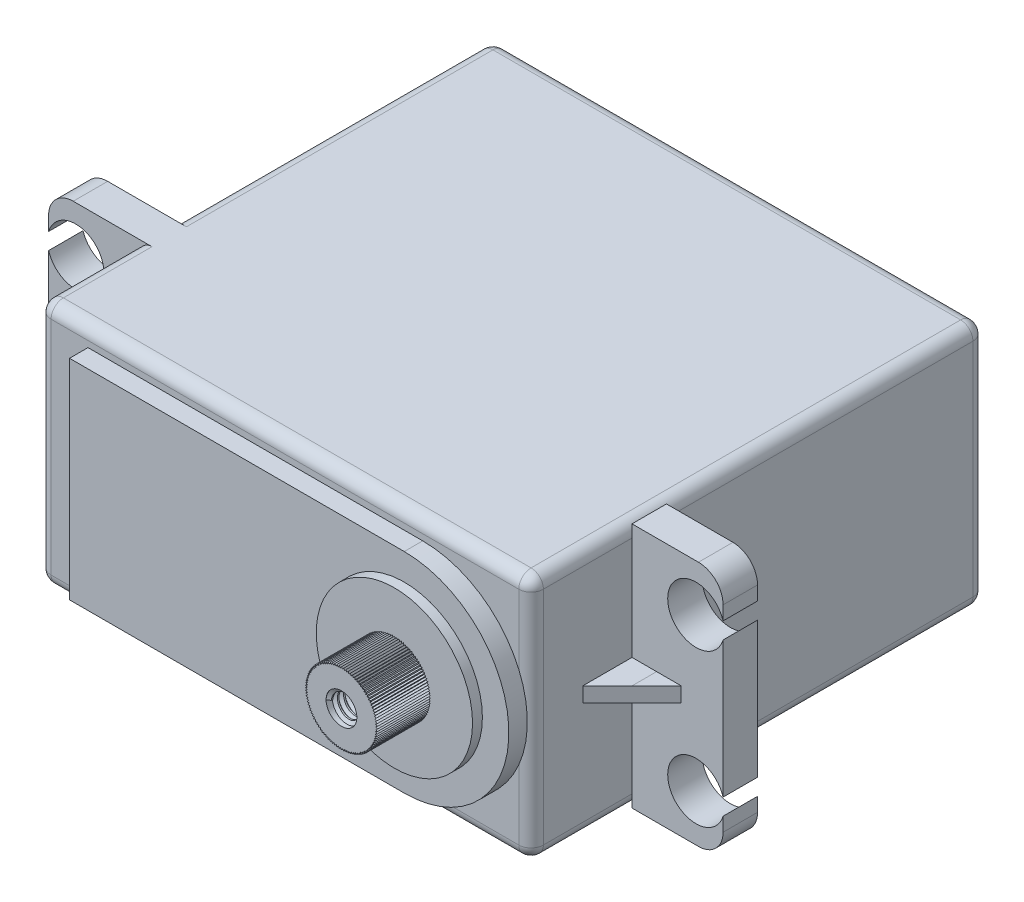
from build123d import *
from build123d.topology import SkipClean

# Parameters (mm, degrees)
SKETCH1_W            = 40
SKETCH1_H            = 20
BOSS_EXTRUDE1_DEPTH  = 36.9
SKETCH2_W            = 2.8
SKETCH2_H            = 20
BOSS_EXTRUDE2_DEPTH  = 7.4
SKETCH3_R            = 2.3
CUT_EXTRUDE1_DEPTH   = 41.920044
FILLET1_R            = 2
RIB5_OUTLINE_W       = 4
RIB5_OUTLINE_H       = 1.2
RIB5_DEPTH           = 4
CUT_EXTRUDE2_DEPTH   = 48.167044
SKETCH6_W            = 3.7
SKETCH6_H            = 6.3
BOSS_EXTRUDE3_DEPTH  = 5
FILLET3_R            = 1
BOSS_EXTRUDE4_DEPTH  = 1.5
SKETCH8_R            = 6.35
BOSS_EXTRUDE5_DEPTH  = 0.8
BOSS_EXTRUDE6_DEPTH  = 4.3
SKETCH10_R           = 1.25
CUT_EXTRUDE3_DEPTH   = 6
THREAD1_PITCH        = 0.5
FILLET1_OF_MIRROR1_R = 2


# Read off the part's stored shape, not the designer's step: Rib5
with BuildPart() as part:
    # Sketch1 → Boss-Extrude1 (new body)
    with BuildSketch(Plane.XY):
        Rectangle(SKETCH1_W, SKETCH1_H)
    extrude(amount=BOSS_EXTRUDE1_DEPTH)

    # Sketch2 → Boss-Extrude2 (add)
    with BuildSketch(Plane.ZY.offset(20)):
        with Locations((27.3, 0)):
            Rectangle(SKETCH2_W, SKETCH2_H)
    boss_extrude2 = extrude(amount=BOSS_EXTRUDE2_DEPTH)

    # Sketch3 → Cut-Extrude1 (cut, through all)
    with BuildSketch(Plane.XY.offset(28.7)):
        with Locations((-25.2, 6.2)):
            Circle(SKETCH3_R)
        with Locations((-25.2, -6.2)):
            Circle(SKETCH3_R)
    cut_extrude1 = extrude(amount=-CUT_EXTRUDE1_DEPTH, mode=Mode.SUBTRACT)

    # Fillet1
    fillet1_edges = [part.edges().sort_by_distance(p)[0] for p in [
        (-27.4, -10, 27.3),
        (-27.4, 10, 27.3),
    ]]
    fillet(fillet1_edges, radius=FILLET1_R)

    # Rib5 outline → Rib5 (add)
    with BuildSketch(Plane.XY.offset(28.7)):
        with Locations((-22, 0)):
            Rectangle(RIB5_OUTLINE_W, RIB5_OUTLINE_H)
    rib5 = extrude(amount=RIB5_DEPTH)

    # Sketch5 → Cut-Extrude2 (cut, through all)
    with BuildSketch(Plane.XZ.offset(0.6)):
        Polygon((-24, 32.7), (-24, 28.7), (-20, 32.7), align=None)
    cut_extrude2 = extrude(amount=-CUT_EXTRUDE2_DEPTH, mode=Mode.SUBTRACT)

    # Sketch6 → Boss-Extrude3 (add)
    with BuildSketch(Plane.ZY.offset(20)):
        with Locations((4.098205, 0)):
            Rectangle(SKETCH6_W, SKETCH6_H)
    extrude(amount=BOSS_EXTRUDE3_DEPTH)

    # Fillet3
    fillet3_edges = [part.edges().sort_by_distance(p)[0] for p in [
        (-20, 0, 5.948205),
        (-22.5, -3.15, 5.948205),
        (-20, 3.15, 4.098205),
        (-22.5, 3.15, 5.948205),
        (-20, 0, 2.248205),
        (-22.5, 3.15, 2.248205),
        (-20, -3.15, 4.098205),
        (-22.5, -3.15, 2.248205),
        (-25, 0, 5.948205),
        (-25, 3.15, 4.098205),
        (-25, 0, 2.248205),
        (-25, -3.15, 4.098205),
        (-20, 0, 36.9),
        (-20, -10, 12.95),
        (-20, 10, 12.95),
        (0, -10, 36.9),
        (20, 0, 36.9),
        (0, -10, 0),
        (-20, 0, 0),
        (0, 10, 0),
        (20, 0, 0),
        (20, -10, 18.45),
        (-20, -10, 32.8),
        (-20, 10, 32.8),
        (20, 10, 18.45),
        (0, 10, 36.9),
    ]]
    fillet(fillet3_edges, radius=FILLET3_R)

    # Sketch7 → Boss-Extrude4 (add)
    with BuildSketch(Plane.XY.offset(36.9)):
        with BuildLine():
            Line((-16, 8.5), (11.194571, 8.5))
            ThreePointArc((11.194571, 8.5), (19.694571, 0), (11.194571, -8.5))
            Line((11.194571, -8.5), (-16, -8.5))
            Line((-16, -8.5), (-16, 8.5))
        make_face()
    extrude(amount=BOSS_EXTRUDE4_DEPTH)

    # Sketch8 → Boss-Extrude5 (add)
    with BuildSketch(Plane.XY.offset(38.4)):
        with Locations((11.194571, 0)):
            Circle(SKETCH8_R)
    extrude(amount=BOSS_EXTRUDE5_DEPTH)

    # Sketch9 → Boss-Extrude6 (add)
    with BuildSketch(Plane.XY.offset(39.2)):
        Polygon((11.194571, 2.941835), (11.107151, 2.798635), (11.010911, 2.936063), (10.932655, 2.787657), (10.827976, 2.918771), (10.759192, 2.765743), (10.646487, 2.890026), (10.587448, 2.732981), (10.467162, 2.849942), (10.4181, 2.6895), (10.290707, 2.798677), (10.251816, 2.635471), (10.117819, 2.736434), (10.089253, 2.571108), (9.949181, 2.663457), (9.931052, 2.496664), (9.785458, 2.580036), (9.777838, 2.412434), (9.627296, 2.486499), (9.630215, 2.318749), (9.475319, 2.383216), (9.488766, 2.215981), (9.330128, 2.270594), (9.354048, 2.104533), (9.192294, 2.149078), (9.226595, 1.984846), (9.062363, 2.019146), (9.106908, 1.857392), (8.940846, 1.881313), (8.99546, 1.722675), (8.828224, 1.736121), (8.892691, 1.581226), (8.724941, 1.584144), (8.799006, 1.433602), (8.631404, 1.425982), (8.714776, 1.280388), (8.547983, 1.262259), (8.640332, 1.122187), (8.475007, 1.093621), (8.575969, 0.959624), (8.412763, 0.920733), (8.52194, 0.79334), (8.361499, 0.744279), (8.478459, 0.623992), (8.321415, 0.564953), (8.445697, 0.452248), (8.29267, 0.383465), (8.423784, 0.278786), (8.275377, 0.20053), (8.412805, 0.10429), (8.269605, 0.016869), (8.412805, -0.070551), (8.275377, -0.166791), (8.423784, -0.245047), (8.29267, -0.349726), (8.445697, -0.418509), (8.321415, -0.531214), (8.478459, -0.590254), (8.361499, -0.71054), (8.52194, -0.759602), (8.412763, -0.886995), (8.575969, -0.925885), (8.475007, -1.059882), (8.640332, -1.088448), (8.547983, -1.22852), (8.714776, -1.246649), (8.631404, -1.392243), (8.799006, -1.399864), (8.724941, -1.550406), (8.892691, -1.547487), (8.828224, -1.702382), (8.99546, -1.688936), (8.940846, -1.847574), (9.106908, -1.823653), (9.062363, -1.985407), (9.226595, -1.951107), (9.192294, -2.115339), (9.354048, -2.070794), (9.330128, -2.236855), (9.488766, -2.182242), (9.475319, -2.349477), (9.630215, -2.285011), (9.627296, -2.452761), (9.777838, -2.378695), (9.785458, -2.546297), (9.931052, -2.462925), (9.949181, -2.629719), (10.089253, -2.537369), (10.117819, -2.702695), (10.251816, -2.601732), (10.290707, -2.764938), (10.4181, -2.655761), (10.467162, -2.816203), (10.587448, -2.699242), (10.646487, -2.856287), (10.759192, -2.732004), (10.827976, -2.885032), (10.932655, -2.753918), (11.010911, -2.902324), (11.107151, -2.764896), (11.194571, -2.908096), (11.281992, -2.764896), (11.378231, -2.902324), (11.456488, -2.753918), (11.561166, -2.885032), (11.62995, -2.732004), (11.742655, -2.856287), (11.801694, -2.699242), (11.92198, -2.816203), (11.971042, -2.655761), (12.098435, -2.764938), (12.137326, -2.601732), (12.271323, -2.702695), (12.299889, -2.537369), (12.439961, -2.629719), (12.45809, -2.462925), (12.603684, -2.546297), (12.611304, -2.378695), (12.761846, -2.452761), (12.758927, -2.285011), (12.913823, -2.349477), (12.900376, -2.182242), (13.059014, -2.236855), (13.035094, -2.070794), (13.196848, -2.115339), (13.162547, -1.951107), (13.326779, -1.985407), (13.282234, -1.823653), (13.448296, -1.847574), (13.393682, -1.688936), (13.560918, -1.702382), (13.496451, -1.547487), (13.664201, -1.550406), (13.590136, -1.399864), (13.757738, -1.392243), (13.674366, -1.246649), (13.841159, -1.22852), (13.74881, -1.088448), (13.914135, -1.059882), (13.813173, -0.925885), (13.976379, -0.886995), (13.867202, -0.759602), (14.027643, -0.71054), (13.910683, -0.590254), (14.067727, -0.531214), (13.943445, -0.418509), (14.096472, -0.349726), (13.965358, -0.245047), (14.113765, -0.166791), (13.976337, -0.070551), (14.119537, 0.016869), (13.976337, 0.10429), (14.113765, 0.20053), (13.965358, 0.278786), (14.096472, 0.383465), (13.943445, 0.452248), (14.067727, 0.564953), (13.910683, 0.623992), (14.027643, 0.744279), (13.867202, 0.79334), (13.976379, 0.920733), (13.813173, 0.959624), (13.914135, 1.093621), (13.74881, 1.122187), (13.841159, 1.262259), (13.674366, 1.280388), (13.757738, 1.425982), (13.590136, 1.433602), (13.664201, 1.584144), (13.496451, 1.581226), (13.560918, 1.736121), (13.393682, 1.722675), (13.448296, 1.881313), (13.282234, 1.857392), (13.326779, 2.019146), (13.162547, 1.984846), (13.196848, 2.149078), (13.035094, 2.104533), (13.059014, 2.270594), (12.900376, 2.215981), (12.913823, 2.383216), (12.758927, 2.318749), (12.761846, 2.486499), (12.611304, 2.412434), (12.603684, 2.580036), (12.45809, 2.496664), (12.439961, 2.663457), (12.299889, 2.571108), (12.271323, 2.736434), (12.137326, 2.635471), (12.098435, 2.798677), (11.971042, 2.6895), (11.92198, 2.849942), (11.801694, 2.732981), (11.742655, 2.890026), (11.62995, 2.765743), (11.561166, 2.918771), (11.456488, 2.787657), (11.378231, 2.936063), (11.281992, 2.798635), align=None)
    extrude(amount=BOSS_EXTRUDE6_DEPTH)

    # Sketch10 → Cut-Extrude3 (cut)
    with BuildSketch(Plane.XY.offset(43.5)):
        with Locations((11.194571, 0)):
            Circle(SKETCH10_R)
    extrude(amount=-CUT_EXTRUDE3_DEPTH, mode=Mode.SUBTRACT)

    # Thread1: the profile of Thread Profile1 profile screwed along a right-hand helix of 12 turns, 6 arcs to a turn; built about Z, then put on its axis
    with SkipClean():  # the faces are left unmerged after this step: merging them gives an invalid solid
        thread1_z = Axis((0, 0, 0), (0, 0, 1))
        thread1_corners = [(1.2503, 0, -0.000173), (1.2503, 0, 0.437673), (0.979367, 0, 0.28125), (0.979367, 0, 0.15625)]
        with BuildLine(mode=Mode.PRIVATE) as thread1_profile:
            Line(thread1_corners[0], thread1_corners[1])
            Line(thread1_corners[1], thread1_corners[2])
            Line(thread1_corners[2], thread1_corners[3])
            Line(thread1_corners[3], thread1_corners[0])
        thread1_cap = Face(thread1_profile.wire())
        thread1_turn_angles = [0, 30, 60, 90, 120, 150, 180, 210, 240, 270, 300, 330, 360]
        thread1_turn_weights = [1, 0.8660254037844387, 1, 0.8660254037844387, 1, 0.8660254037844387, 1, 0.8660254037844387, 1, 0.8660254037844387, 1, 0.8660254037844387, 1]
        thread1_turn_rails = [Edge.make_bspline([Vector(p[0], p[1], 0).rotate(thread1_z, thread1_turn_angles[k]) / thread1_turn_weights[k] + Vector(0, 0, p[2] + THREAD1_PITCH * thread1_turn_angles[k] / 360) for k in range(13)], [0, 0, 0, 1, 1, 2, 2, 3, 3, 4, 4, 5, 5, 6, 6, 6], 2, thread1_turn_weights) for p in thread1_corners]
        thread1_turn_sides = [Face.make_surface_from_curves(thread1_turn_rails[p[0]], thread1_turn_rails[p[1]]) for p in [(0, 1), (1, 2), (2, 3), (3, 0)]]
        thread1 = Plane(origin=(11.194571, 0, 43.5), x_dir=(-1, 0, 0), z_dir=(0, 0, -1)) * Solid(Shell([*[p.moved(Location((0, 0, THREAD1_PITCH * i))) for i in range(12) for p in thread1_turn_sides], thread1_cap, thread1_cap.rotate(thread1_z, 4320).moved(Location((0, 0, THREAD1_PITCH * 4320 / 360)))]))
        add(thread1)

    # Mirror1: Boss-Extrude2, Cut-Extrude1, Rib5, Cut-Extrude2 across plane
    with SkipClean():  # the faces are left unmerged after this step: merging them gives an invalid solid
        add(boss_extrude2.mirror(Plane(origin=(0, 0, 0), x_dir=(0, 0, 1), z_dir=(1, 0, 0))))
        add(cut_extrude1.mirror(Plane(origin=(0, 0, 0), x_dir=(0, 0, 1), z_dir=(1, 0, 0))), mode=Mode.SUBTRACT)
        add(rib5.mirror(Plane(origin=(0, 0, 0), x_dir=(0, 0, 1), z_dir=(1, 0, 0))))
        add(cut_extrude2.mirror(Plane(origin=(0, 0, 0), x_dir=(0, 0, 1), z_dir=(1, 0, 0))), mode=Mode.SUBTRACT)

    # Fillet1 of Mirror1
    fillet1_of_mirror1_edges = [part.edges().sort_by_distance(p)[0] for p in [
        (27.4, -10, 27.3),
        (27.4, 10, 27.3),
    ]]
    fillet(fillet1_of_mirror1_edges, radius=FILLET1_OF_MIRROR1_R)


solid = part.part
